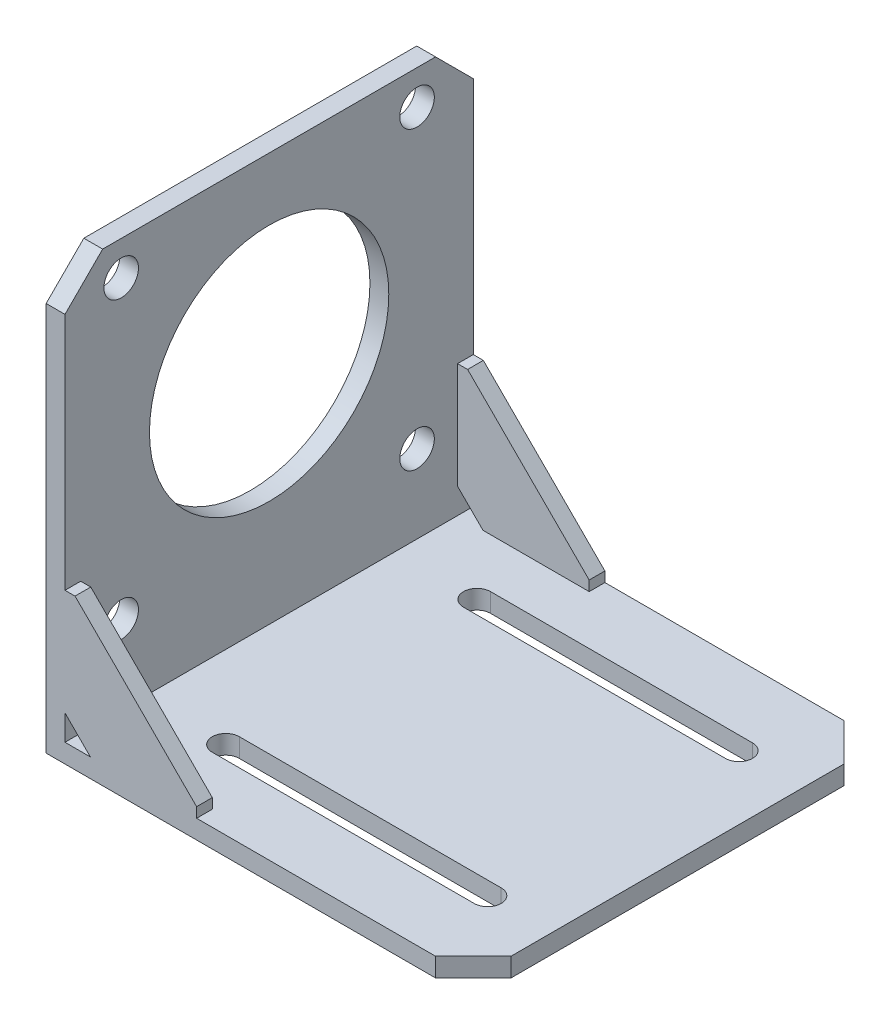
from build123d import *

# Parameters (mm, degrees)
BOSS_EXTRUDE1_DEPTH = 65
CHAMFER1_SIZE       = 6
BOSS_EXTRUDE2_DEPTH = 2.5
SKETCH3_R           = 19.05
SKETCH3_R_2         = 2.75
CUT_EXTRUDE1_DEPTH  = 3
CUT_EXTRUDE2_DEPTH  = 3


with BuildPart() as part:
    # Sketch1 → Boss-Extrude1 (new body)
    with BuildSketch(Plane.XY):
        Polygon((0, 0), (0, 68), (3, 68), (3, 3), (68, 3), (68, 0), align=None)
    extrude(amount=BOSS_EXTRUDE1_DEPTH)

    # Chamfer1
    chamfer1_edges = [part.edges().sort_by_distance(p)[0] for p in [
        (68, 1.5, 65),
        (68, 1.5, 0),
        (1.5, 68, 0),
        (1.5, 68, 65),
    ]]
    chamfer(chamfer1_edges, length=CHAMFER1_SIZE)

    # Sketch2 → Boss-Extrude2 (add)
    with BuildSketch(Plane.XY.offset(65)):
        Polygon((4.600185007, 23.955878092), (23.955878092, 4.600185007), (23.955878092, 3), (7.047822016, 3), (3, 7.047822016), (3, 23.955878092), align=None)
    boss_extrude2 = extrude(amount=-BOSS_EXTRUDE2_DEPTH)

    # Mirror1: Boss-Extrude2 across plane
    add(boss_extrude2.mirror(Plane.XY.offset(32.5)))

    # Sketch3 → Cut-Extrude1 (cut)
    with BuildSketch(Plane.ZY):
        with Locations((32.5, 39)):
            Circle(SKETCH3_R)
        with Locations((8.95, 62.55)):
            Circle(SKETCH3_R_2)
        with Locations((56.05, 62.55)):
            Circle(SKETCH3_R_2)
        with Locations((8.95, 15.45)):
            Circle(SKETCH3_R_2)
        with Locations((56.05, 15.45)):
            Circle(SKETCH3_R_2)
    extrude(amount=-CUT_EXTRUDE1_DEPTH, mode=Mode.SUBTRACT)

    # Sketch4 → Cut-Extrude2 (cut)
    with BuildSketch(Plane.XZ):
        with BuildLine():
            Line((16.1, 54.65), (57.8, 54.65))
            ThreePointArc((57.8, 54.65), (59.95, 52.5), (57.8, 50.35))
            Line((57.8, 50.35), (16.1, 50.35))
            ThreePointArc((16.1, 50.35), (13.95, 52.5), (16.1, 54.65))
        make_face()
        with BuildLine():
            Line((16.1, 14.65), (57.8, 14.65))
            ThreePointArc((57.8, 14.65), (59.95, 12.5), (57.8, 10.35))
            Line((57.8, 10.35), (16.1, 10.35))
            ThreePointArc((16.1, 10.35), (13.95, 12.5), (16.1, 14.65))
        make_face()
    extrude(amount=-CUT_EXTRUDE2_DEPTH, mode=Mode.SUBTRACT)


solid = part.part
